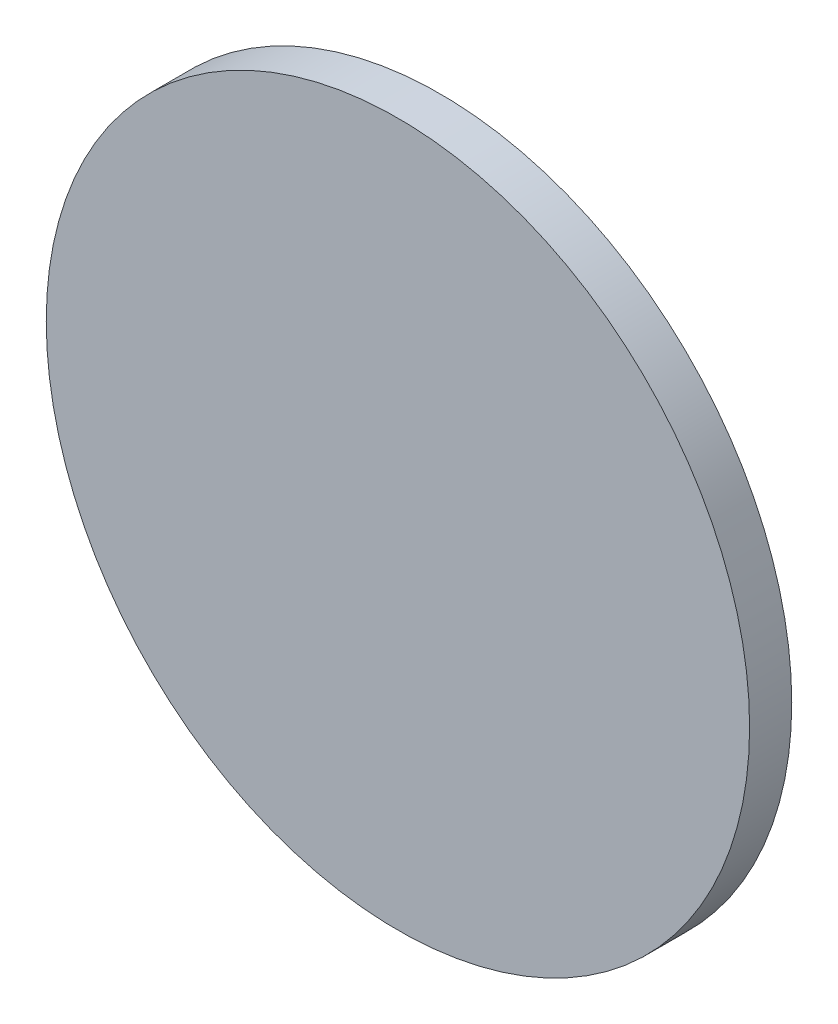
from build123d import *


with BuildPart() as part:
    # Croquis1 → Revolución1 (revolve)
    with BuildSketch(Plane(origin=(0, 0, 0), x_dir=(0, 0, -1), z_dir=(1, 0, 0))):
        Polygon((0, 52.586440388), (0, -63.631994077), (13.927002477, -63.631994077), (13.927002477, 0), (35.057626926, 52.586440388), align=None)
    revolve(axis=Axis((0, 52.586440388, -35.057626926), (0, 0, 1)))


solid = part.part
